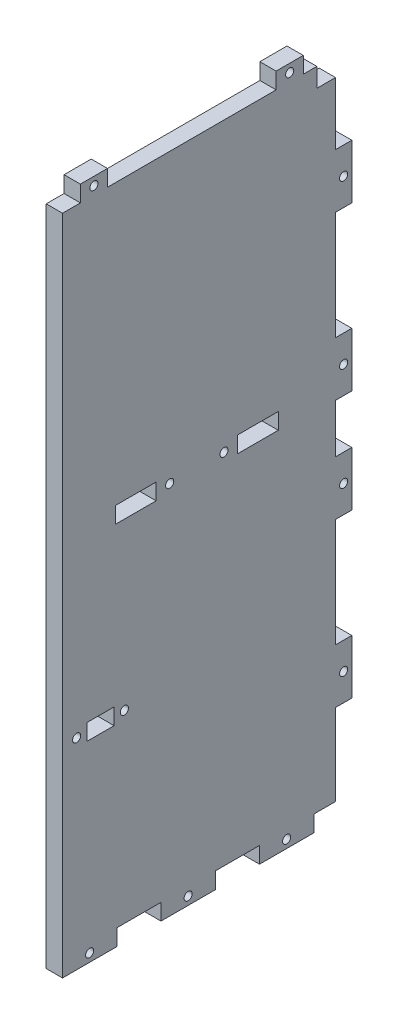
from build123d import *

# Parameters (mm, degrees)
ESQUISSE1_W             = 100.58
ESQUISSE1_H             = 238
ESQUISSE1_W_2           = 10
ESQUISSE1_H_2           = 6
ESQUISSE1_W_3           = 15
BOSS_EXTRU_1_DEPTH      = 6
ESQUISSE3_W             = 20
ESQUISSE3_H             = 6
ESQUISSE3_W_2           = 6
ESQUISSE3_H_2           = 20
ESQUISSE3_W_3           = 10
BOSS_EXTRU_5_DEPTH      = 6
ESQUISSE7_W             = 6.88
ESQUISSE7_H             = 7
ENL_V_MAT_EXTRU_3_DEPTH = 6
ESQUISSE8_R             = 1.5
ENL_V_MAT_EXTRU_4_DEPTH = 6


with BuildPart() as part:
    # Esquisse1 → Boss.-Extru.1 (new body)
    with BuildSketch(Plane(origin=(0, 0, 0), x_dir=(0, 0, -1), z_dir=(1, 0, 0))):
        Rectangle(ESQUISSE1_W, ESQUISSE1_H)
        with Locations((-36.29, -51)):
            Rectangle(ESQUISSE1_W_2, ESQUISSE1_H_2, mode=Mode.SUBTRACT)
        with Locations((-23.295, 13)):
            Rectangle(ESQUISSE1_W_3, ESQUISSE1_H_2, mode=Mode.SUBTRACT)
        with Locations((21.705, 13)):
            Rectangle(ESQUISSE1_W_3, ESQUISSE1_H_2, mode=Mode.SUBTRACT)
    extrude(amount=BOSS_EXTRU_1_DEPTH)

    # Esquisse3 → Boss.-Extru.5 (add)
    with BuildSketch(Plane(origin=(6, 0, 0), x_dir=(0, 0, -1), z_dir=(1, 0, 0))):
        with Locations((-40.29, -122)):
            Rectangle(ESQUISSE3_W, ESQUISSE3_H)
        with Locations((32.29, -122)):
            Rectangle(ESQUISSE3_W, ESQUISSE3_H)
        with Locations((53.29, 19)):
            Rectangle(ESQUISSE3_W_2, ESQUISSE3_H_2)
        with Locations((53.29, 79)):
            Rectangle(ESQUISSE3_W_2, ESQUISSE3_H_2)
        with Locations((53.29, -79)):
            Rectangle(ESQUISSE3_W_2, ESQUISSE3_H_2)
        with Locations((53.29, -19)):
            Rectangle(ESQUISSE3_W_2, ESQUISSE3_H_2)
        with Locations((-4, -122)):
            Rectangle(ESQUISSE3_W, ESQUISSE3_H)
        with Locations((33.41, 122)):
            Rectangle(ESQUISSE3_W_3, ESQUISSE3_H)
        with Locations((-38.71, 122)):
            Rectangle(ESQUISSE3_W_3, ESQUISSE3_H)
    extrude(amount=-BOSS_EXTRU_5_DEPTH)

    # Esquisse7 → Enlèv. mat.-Extru.3 (cut)
    with BuildSketch(Plane.ZY):
        with Locations((-46.85, 115.5)):
            Rectangle(ESQUISSE7_W, ESQUISSE7_H)
    extrude(amount=-ENL_V_MAT_EXTRU_3_DEPTH, mode=Mode.SUBTRACT)

    # Esquisse8 → Enlèv. mat.-Extru.4 (cut)
    with BuildSketch(Plane.ZY):
        with Locations((4, -122)):
            Circle(ESQUISSE8_R)
        with Locations((-9.205, 13)):
            Circle(ESQUISSE8_R)
        with Locations((10.795, 13)):
            Circle(ESQUISSE8_R)
        with Locations((27.5, -51)):
            Circle(ESQUISSE8_R)
        with Locations((45.08, -51)):
            Circle(ESQUISSE8_R)
        with Locations((38.71, 122)):
            Circle(ESQUISSE8_R)
        with Locations((-33.41, 122)):
            Circle(ESQUISSE8_R)
        with Locations((40.29, -122)):
            Circle(ESQUISSE8_R)
        with Locations((-53.29, 79)):
            Circle(ESQUISSE8_R)
        with Locations((-32.29, -122)):
            Circle(ESQUISSE8_R)
        with Locations((-53.29, 19)):
            Circle(ESQUISSE8_R)
        with Locations((-53.29, -79)):
            Circle(ESQUISSE8_R)
        with Locations((-53.29, -19)):
            Circle(ESQUISSE8_R)
    extrude(amount=-ENL_V_MAT_EXTRU_4_DEPTH, mode=Mode.SUBTRACT)


solid = part.part
